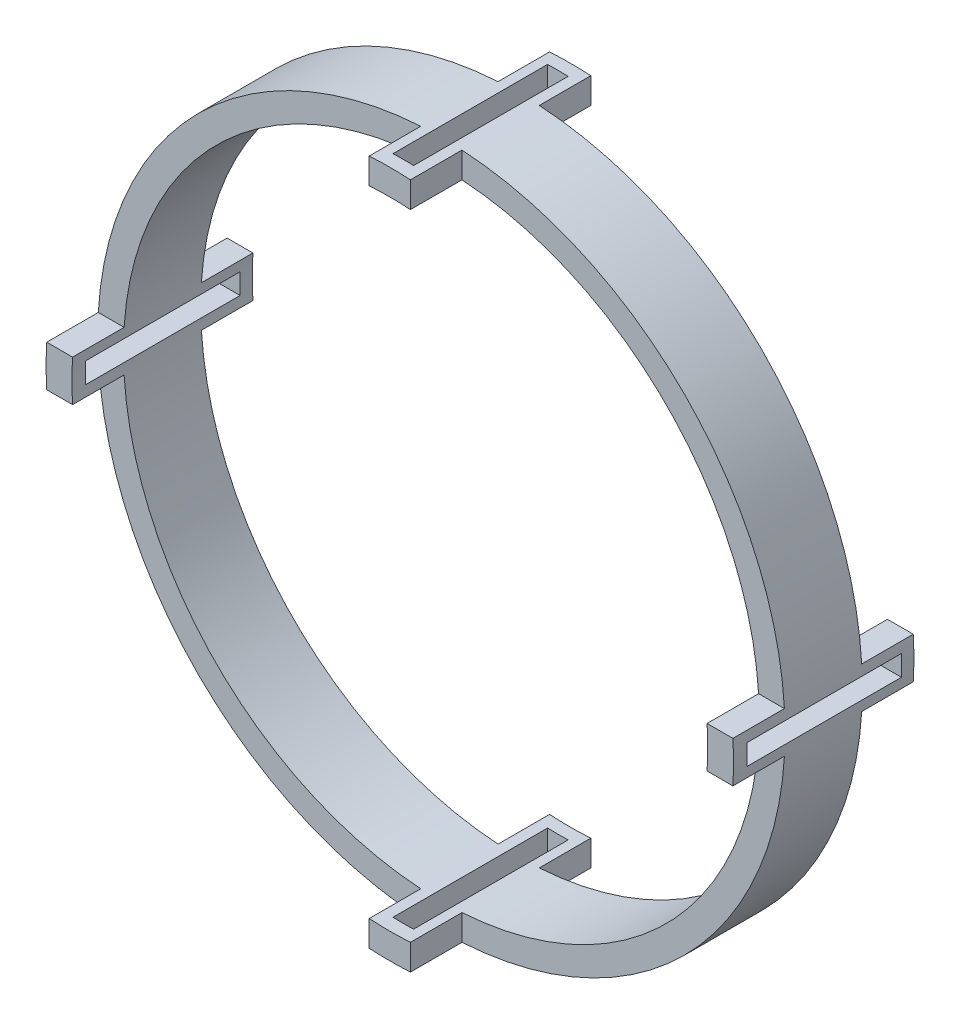
from build123d import *

# Parameters (mm, degrees)
SKETCH1_R                = 84.709
SKETCH1_R_2              = 78.359
BOSS_EXTRUDE1_DEPTH      = 19.05
BOSS_EXTRUDE2_DEPTH      = 12.7
BOSS_EXTRUDE2_DEPTH_BACK = 31.75
SKETCH2_W                = 5.08
SKETCH2_H                = 38.1
CUT_EXTRUDE1_DEPTH       = 124.932610164
CIRPATTERN1_COUNT        = 4


with BuildPart() as part:
    # Sketch1 → Boss-Extrude1 (new body)
    with BuildSketch(Plane.XY):
        Circle(SKETCH1_R)
        Circle(SKETCH1_R_2, mode=Mode.SUBTRACT)
    extrude(amount=BOSS_EXTRUDE1_DEPTH)

    # Sketch3 → Boss-Extrude2 (add, two sides: drawn at the far end of the back side and taken through both)
    with BuildSketch(Plane(origin=(0, 0, 0), x_dir=(-1, 0, 0), z_dir=(0, 0, -1)).offset(-BOSS_EXTRUDE2_DEPTH_BACK)):
        with BuildLine():
            Line((-5.08, 78.194158868), (-5.08, 84.556538961))
            ThreePointArc((-5.08, 84.556538961), (0, 84.709), (5.08, 84.556538961))
            Line((5.08, 84.556538961), (5.08, 78.194158868))
            ThreePointArc((5.08, 78.194158868), (0, 78.359), (-5.08, 78.194158868))
        make_face()
        with BuildLine():
            Line((-5.08, -78.194158868), (-5.08, -84.556538961))
            ThreePointArc((-5.08, -84.556538961), (0, -84.709), (5.08, -84.556538961))
            Line((5.08, -84.556538961), (5.08, -78.194158868))
            ThreePointArc((5.08, -78.194158868), (0, -78.359), (-5.08, -78.194158868))
        make_face()
        with BuildLine():
            Line((78.194158868, -5.08), (84.556538961, -5.08))
            ThreePointArc((84.556538961, -5.08), (84.709, 0), (84.556538961, 5.08))
            Line((84.556538961, 5.08), (78.194158868, 5.08))
            ThreePointArc((78.194158868, 5.08), (78.359, 0), (78.194158868, -5.08))
        make_face()
        with BuildLine():
            Line((-78.194158868, 5.08), (-84.556538961, 5.08))
            ThreePointArc((-84.556538961, 5.08), (-84.709, 0), (-84.556538961, -5.08))
            Line((-84.556538961, -5.08), (-78.194158868, -5.08))
            ThreePointArc((-78.194158868, -5.08), (-78.359, 0), (-78.194158868, 5.08))
        make_face()
    extrude(amount=BOSS_EXTRUDE2_DEPTH + BOSS_EXTRUDE2_DEPTH_BACK)

    # Sketch2 → Cut-Extrude1 (cut, through all)
    with BuildSketch(Plane(origin=(0, 0, 0), x_dir=(1, 0, 0), z_dir=(0, 1, 0))):
        with Locations((0, -9.381820704)):
            Rectangle(SKETCH2_W, SKETCH2_H)
    cut_extrude1 = extrude(amount=-CUT_EXTRUDE1_DEPTH, mode=Mode.SUBTRACT)

    # CirPattern1: Cut-Extrude1 ×4 about axis
    cirpattern1_axis = Axis((0, 0, 2.080715754), (0, 0, 1))
    for i in range(1, CIRPATTERN1_COUNT):
        add(cut_extrude1.rotate(cirpattern1_axis, i * 360 / CIRPATTERN1_COUNT), mode=Mode.SUBTRACT)


solid = part.part
